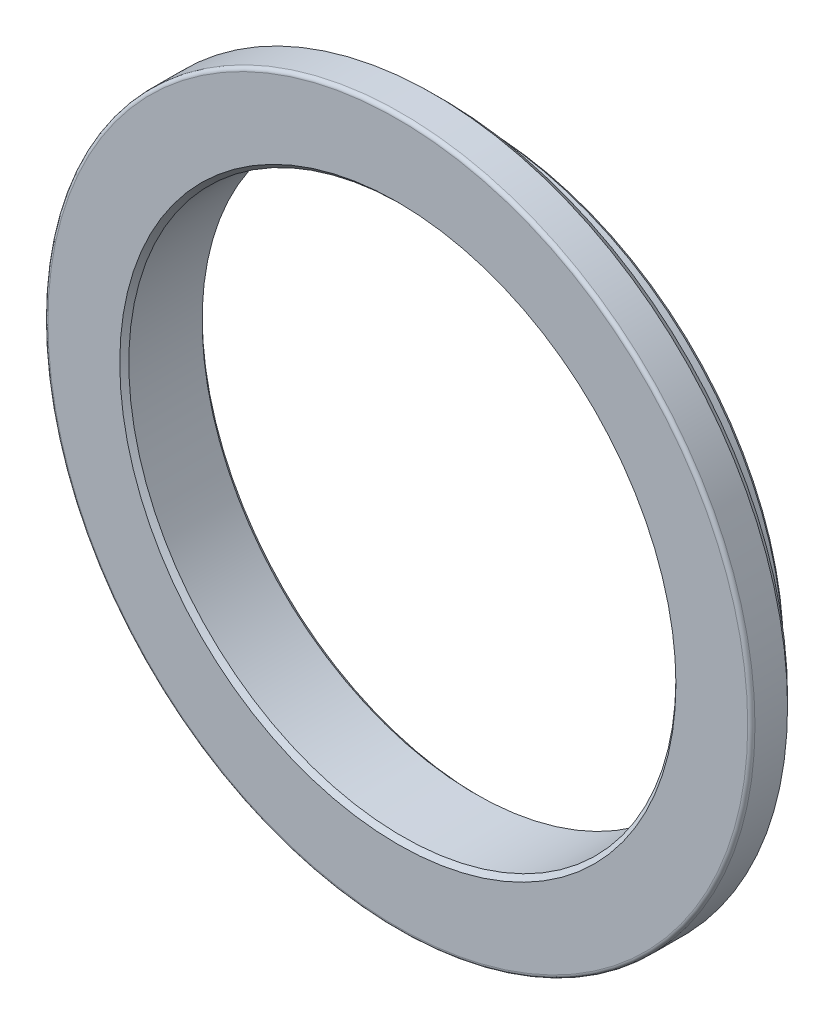
from build123d import *


with BuildPart() as part:
    # Sketch1 → Revolve1 (revolve)
    with BuildSketch(Plane(origin=(0, 0, 0), x_dir=(0, 0, -1), z_dir=(1, 0, 0))):
        with BuildLine():
            Line((0, 30.725), (0.5, 30.225))
            Line((0.5, 30.225), (8.6, 30.225))
            Line((8.6, 30.225), (9.1, 30.725))
            Line((9.1, 30.725), (9.1, 33.5))
            Line((9.1, 33.5), (8.6, 34))
            Line((8.6, 34), (5.4, 34))
            ThreePointArc((5.4, 34), (5.117157288, 34.117157288), (5, 34.4))
            Line((5, 34.4), (5, 38.06))
            Line((5, 38.06), (4, 39.06))
            Line((4, 39.06), (0.4, 39.06))
            ThreePointArc((0.4, 39.06), (0.117157288, 38.942842712), (0, 38.66))
            Line((0, 38.66), (0, 30.725))
        make_face()
    revolve(axis=Axis((0, 0, 0), (0, 0, -1)))


solid = part.part
